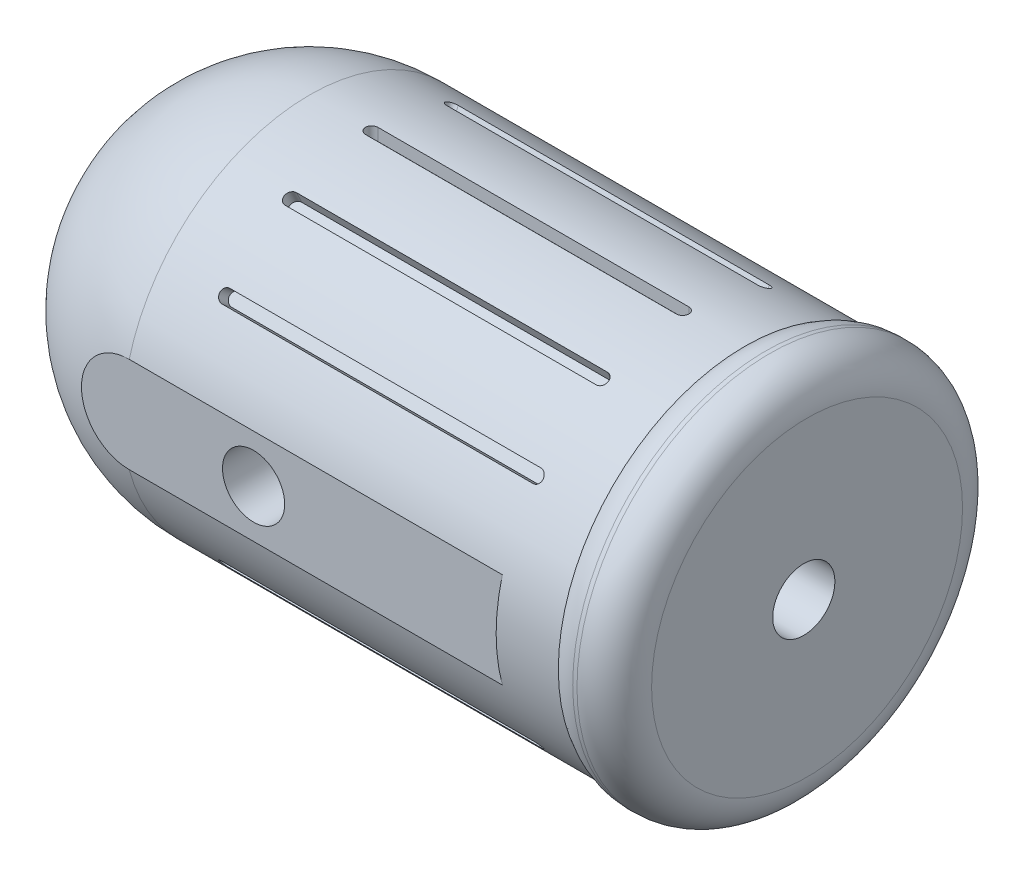
from build123d import *
from OCP.BRepFilletAPI import BRepFilletAPI_MakeFillet

# Parameters (mm, degrees)
FILLET1_R                                  = 3
SKETCH3_R                                  = 2.5
CUT_EXTRUDE1_DEPTH                         = 5
CUT_EXTRUDE2_START                         = 15
SKETCH4_R                                  = 2.5
CUT_EXTRUDE2_DEPTH                         = 5
CUT_EXTRUDE3_START                         = 15
CUT_EXTRUDE3_DEPTH                         = 1
CIRPATTERN1_COUNT                          = 14
SKETCH6_W                                  = 40
SKETCH6_H                                  = 5
CUT_EXTRUDE4_DEPTH                         = 46.612498355
MIRROR3_AT_THE_SECOND_PLANE_COPY_1_SKETC_W = 40
MIRROR3_AT_THE_SECOND_PLANE_COPY_1_SKETC_H = 5
MIRROR3_AT_THE_SECOND_PLANE_COPY_1_DEPTH   = 46.612498355
CUT_EXTRUDE5_START                         = -15
SKETCH7_R                                  = 5
SKETCH7_R_2                                = 3
CUT_EXTRUDE5_DEPTH                         = 10
FILLET2_R                                  = 2
FILLET2_R_2                                = 1


# Some blends are built 0.0001 mm under size
with BuildPart() as part:
    # Sketch2 → Revolve1 (revolve)
    with BuildSketch(Plane.XY, mode=Mode.PRIVATE) as revolve1_sk:
        with BuildLine():
            Line((0, 15), (35, 15))
            Line((35, 15), (35, 15.5))
            Line((35, 15.5), (40, 15.5))
            Line((40, 15.5), (40, 0))
            Line((40, 0), (-15, 0))
            ThreePointArc((-15, 0), (-10.606601718, 10.606601718), (0, 15))
        make_face()
    revolve(revolve1_sk.sketch.rotate(Axis((-15, 0, 0), (1, 0, 0)), 90), axis=Axis((-15, 0, 0), (1, 0, 0)))

    # Fillet1
    # the kernel refuses this fillet: 3 mm, written as the material it takes off along each edge
    with BuildSketch(Plane(origin=(35, 0, 0), x_dir=(0, 0, 1), z_dir=(0, 1, 0))) as fillet1_piece_1:
        with BuildLine():
            CenterArc((12.5, 1.658312395), FILLET1_R, 326.442690238, 33.557309762)
            Line((15.5, 1.658312395), (15.56, 1.658312395))
            Line((15.56, 1.658312395), (15.56, 0))
            Line((15.56, 0), (15.5, -0.06))
            ThreePointArc((15.5, -0.06), (15.25, -0.06), (15.05, -0.033166248))
            Line((15.05, -0.033166248), (15, 0))
        make_face()
    revolve(axis=Axis((35, 0, 0), (1, 0, 0)), mode=Mode.SUBTRACT)
    with BuildSketch(Plane(origin=(40, 0, 0), x_dir=(0, 0, 1), z_dir=(0, 1, 0))) as fillet1_piece_2:
        with BuildLine():
            CenterArc((15.5 - FILLET1_R, -FILLET1_R), FILLET1_R, 0, 90)
            Line((15.5 - FILLET1_R, 0), (15.5 - FILLET1_R, FILLET1_R * 0.02))
            Line((15.5 - FILLET1_R, FILLET1_R * 0.02), (15.5 + FILLET1_R * 0.02, FILLET1_R * 0.02))
            Line((15.5 + FILLET1_R * 0.02, FILLET1_R * 0.02), (15.5 + FILLET1_R * 0.02, -FILLET1_R))
            Line((15.5 + FILLET1_R * 0.02, -FILLET1_R), (15.5, -FILLET1_R))
        make_face()
    revolve(axis=Axis((40, 0, 0), (1, 0, 0)), mode=Mode.SUBTRACT)

    # Sketch3 → Cut-Extrude1 (cut)
    with BuildSketch(Plane(origin=(40, 0, 0), x_dir=(0, 0, -1), z_dir=(1, 0, 0))):
        with Locations((-0.26373736, 0)):
            Circle(SKETCH3_R)
    extrude(amount=-CUT_EXTRUDE1_DEPTH, mode=Mode.SUBTRACT)

    # Sketch4 → Cut-Extrude2 (cut)
    with BuildSketch(Plane.XY.offset(CUT_EXTRUDE2_START)):
        with Locations((10, 0)):
            Circle(SKETCH4_R)
    cut_extrude2 = extrude(amount=-CUT_EXTRUDE2_DEPTH, mode=Mode.SUBTRACT)

    # Mirror1: Cut-Extrude2 across plane
    add(cut_extrude2.mirror(Plane.XY), mode=Mode.SUBTRACT)

    # Sketch5 → Cut-Extrude3 (cut)
    with BuildSketch(Plane(origin=(0, 0, 0), x_dir=(1, 0, 0), z_dir=(0, 1, 0)).offset(CUT_EXTRUDE3_START)):
        with BuildLine():
            Line((30, -0.5), (5, -0.5))
            ThreePointArc((5, -0.5), (4.5, 0), (5, 0.5))
            Line((5, 0.5), (30, 0.5))
            ThreePointArc((30, 0.5), (30.5, 0), (30, -0.5))
        make_face()
    cut_extrude3 = extrude(amount=-CUT_EXTRUDE3_DEPTH, mode=Mode.SUBTRACT)

    # CirPattern1: Cut-Extrude3 ×14 about axis, 4 skipped
    cirpattern1_axis = Axis((0, 0, 0), (-1, 0, 0))
    add([cut_extrude3.rotate(cirpattern1_axis, i * 360 / CIRPATTERN1_COUNT) for i in range(1, CIRPATTERN1_COUNT) if i not in (3, 4, 10, 11)], mode=Mode.SUBTRACT)

    # Sketch6 → Cut-Extrude4 (cut, symmetric)
    with BuildSketch(Plane(origin=(0, 0, 0), x_dir=(1, 0, 0), z_dir=(0, 1, 0))):
        with Locations((10, 17)):
            Rectangle(SKETCH6_W, SKETCH6_H)
    cut_extrude4 = extrude(amount=CUT_EXTRUDE4_DEPTH, both=True, mode=Mode.SUBTRACT)

    # Mirror3: Cut-Extrude4 across plane
    add(cut_extrude4.mirror(Plane.ZX), mode=Mode.SUBTRACT)

    # Mirror3 at the second plane: Cut-Extrude4 across plane
    add(cut_extrude4.mirror(Plane.XY), mode=Mode.SUBTRACT)

    # Mirror3 at the second plane copy 1 sketc → Mirror3 at the second plane copy 1 (cut, symmetric)
    with BuildSketch(Plane.XZ):
        with Locations((10, 17)):
            Rectangle(MIRROR3_AT_THE_SECOND_PLANE_COPY_1_SKETC_W, MIRROR3_AT_THE_SECOND_PLANE_COPY_1_SKETC_H)
    extrude(amount=MIRROR3_AT_THE_SECOND_PLANE_COPY_1_DEPTH, both=True, mode=Mode.SUBTRACT)

    # Sketch7 → Cut-Extrude5 (cut)
    with BuildSketch(Plane(origin=(0, 0, 0), x_dir=(0, 0, -1), z_dir=(1, 0, 0)).offset(CUT_EXTRUDE5_START)):
        Circle(SKETCH7_R)
        Circle(SKETCH7_R_2, mode=Mode.SUBTRACT)
    extrude(amount=CUT_EXTRUDE5_DEPTH, mode=Mode.SUBTRACT)

    # Fillet2
    fillet2_edges_1 = [part.edges().sort_by_distance(p)[0] for p in [
        (-5, 0, 5),
        (-14.142135624, 5, 0),
    ]]
    fillet2_edges_2 = [part.edges().sort_by_distance(p)[0] for p in [
        (-14.696938457, -3, 0),
    ]]
    fillet2 = BRepFilletAPI_MakeFillet(part.part.solid().wrapped)
    for e in fillet2_edges_1:
        fillet2.Add(FILLET2_R - 0.0001, e.wrapped)
    for e in fillet2_edges_2:
        fillet2.Add(FILLET2_R_2 - 0.0001, e.wrapped)
    add(Compound.cast(fillet2.Shape()), mode=Mode.REPLACE)  # a hair under: the kernel refuses the full size


solid = part.part
